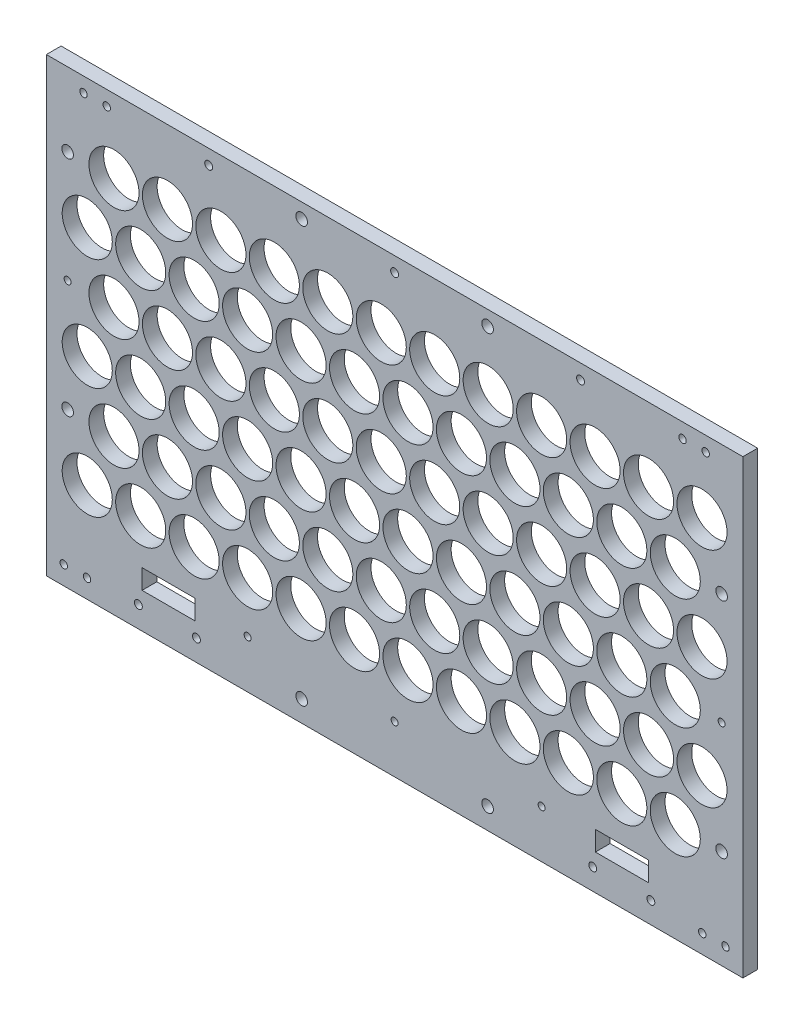
from build123d import *

# Parameters (mm, degrees)
SKETCH1_W                  = 299.700000132
SKETCH1_H                  = 194.250000104
BOSS_EXTRUDE1_DEPTH        = 6.35
CUT_EXTRUDE1_DEPTH         = 182.719853184
SKETCH4_R                  = 10.775
CUT_EXTRUDE2_DEPTH         = 182.719853184
LPATTERN1_COUNT            = 12
LPATTERN1_PITCH            = 23
LPATTERN2_COPY_1_DEPTH     = 182.719853184
LPATTERN2_COPY_2_DEPTH     = 182.719853184
LPATTERN2_COPY_3_DEPTH     = 182.719853184
LPATTERN2_COPY_4_DEPTH     = 182.719853184
LPATTERN2_COPY_5_DEPTH     = 182.719853184
LPATTERN2_COPY_6_DEPTH     = 182.719853184
LPATTERN2_COPY_7_DEPTH     = 182.719853184
LPATTERN2_COPY_8_DEPTH     = 182.719853184
LPATTERN2_COPY_9_DEPTH     = 182.719853184
LPATTERN2_COPY_10_DEPTH    = 182.719853184
LPATTERN2_COPY_11_DEPTH    = 182.719853184
LPATTERN2_COPY_12_DEPTH    = 182.719853184
LPATTERN2_COPY_13_DEPTH    = 182.719853184
LPATTERN2_COPY_14_DEPTH    = 182.719853184
LPATTERN2_COPY_15_DEPTH    = 182.719853184
LPATTERN2_COPY_16_DEPTH    = 182.719853184
LPATTERN2_COPY_17_DEPTH    = 182.719853184
LPATTERN2_COPY_18_DEPTH    = 182.719853184
LPATTERN2_COPY_19_DEPTH    = 182.719853184
LPATTERN2_COPY_20_DEPTH    = 182.719853184
LPATTERN2_COPY_21_DEPTH    = 182.719853184
LPATTERN2_COPY_22_DEPTH    = 182.719853184
LPATTERN2_COPY_23_SKETCH_R = 10.775
LPATTERN2_COPY_23_DEPTH    = 182.719853184
LPATTERN2_COPY_24_SKETCH_R = 10.775
LPATTERN2_COPY_24_DEPTH    = 182.719853184
LPATTERN2_COPY_25_SKETCH_R = 10.775
LPATTERN2_COPY_25_DEPTH    = 182.719853184
LPATTERN2_COPY_26_SKETCH_R = 10.775
LPATTERN2_COPY_26_DEPTH    = 182.719853184
LPATTERN2_COPY_27_SKETCH_R = 10.775
LPATTERN2_COPY_27_DEPTH    = 182.719853184
LPATTERN2_COPY_28_SKETCH_R = 10.775
LPATTERN2_COPY_28_DEPTH    = 182.719853184
LPATTERN2_COPY_29_SKETCH_R = 10.775
LPATTERN2_COPY_29_DEPTH    = 182.719853184
LPATTERN2_COPY_30_SKETCH_R = 10.775
LPATTERN2_COPY_30_DEPTH    = 182.719853184
LPATTERN2_COPY_31_SKETCH_R = 10.775
LPATTERN2_COPY_31_DEPTH    = 182.719853184
LPATTERN2_COPY_32_SKETCH_R = 10.775
LPATTERN2_COPY_32_DEPTH    = 182.719853184
LPATTERN2_COPY_33_SKETCH_R = 10.775
LPATTERN2_COPY_33_DEPTH    = 182.719853184
LPATTERN2_COPY_34_SKETCH_R = 10.775
LPATTERN2_COPY_34_DEPTH    = 182.719853184
LPATTERN2_COPY_35_SKETCH_R = 10.775
LPATTERN2_COPY_35_DEPTH    = 182.719853184
LPATTERN2_COPY_36_SKETCH_R = 10.775
LPATTERN2_COPY_36_DEPTH    = 182.719853184
LPATTERN2_COPY_37_SKETCH_R = 10.775
LPATTERN2_COPY_37_DEPTH    = 182.719853184
LPATTERN2_COPY_38_SKETCH_R = 10.775
LPATTERN2_COPY_38_DEPTH    = 182.719853184
LPATTERN2_COPY_39_SKETCH_R = 10.775
LPATTERN2_COPY_39_DEPTH    = 182.719853184
LPATTERN2_COPY_40_SKETCH_R = 10.775
LPATTERN2_COPY_40_DEPTH    = 182.719853184
LPATTERN2_COPY_41_SKETCH_R = 10.775
LPATTERN2_COPY_41_DEPTH    = 182.719853184
LPATTERN2_COPY_42_SKETCH_R = 10.775
LPATTERN2_COPY_42_DEPTH    = 182.719853184
LPATTERN2_COPY_43_SKETCH_R = 10.775
LPATTERN2_COPY_43_DEPTH    = 182.719853184
LPATTERN2_COPY_44_SKETCH_R = 10.775
LPATTERN2_COPY_44_DEPTH    = 182.719853184
LPATTERN2_COPY_45_DEPTH    = 182.719853184
LPATTERN2_COPY_46_DEPTH    = 182.719853184
LPATTERN2_COPY_47_SKETCH_R = 10.775
LPATTERN2_COPY_47_DEPTH    = 182.719853184
LPATTERN2_COPY_48_SKETCH_R = 10.775
LPATTERN2_COPY_48_DEPTH    = 182.719853184
SKETCH5_W                  = 22.76
SKETCH5_H                  = 8.4615
CUT_EXTRUDE3_DEPTH         = 182.719853184
M3_CLEARANCE_HOLE1_D       = 3.2
M3_CLEARANCE_HOLE2_D       = 3.4
SKETCH14_R                 = 1.5
CUT_EXTRUDE4_DEPTH         = 182.719853184
SKETCH15_R                 = 2.5
CUT_EXTRUDE5_DEPTH         = 182.719853184


with BuildPart() as part:
    # Sketch1 → Boss-Extrude1 (new body)
    with BuildSketch(Plane.XY):
        with Locations((0, -5.475000052)):
            Rectangle(SKETCH1_W, SKETCH1_H)
    extrude(amount=BOSS_EXTRUDE1_DEPTH)

    # Sketch3 → Cut-Extrude1 (cut, through all)
    with BuildSketch(Plane.XY.offset(6.35)):
        with BuildLine():
            ThreePointArc((-121.475, -60), (-132.24999993, -49.225), (-143.025, -59.999999859))
            ThreePointArc((-143.025, -59.999999859), (-139.869075617, -67.619075517), (-132.25, -70.775))
            ThreePointArc((-132.25, -70.775), (-124.630924433, -67.619075567), (-121.475, -60))
        make_face()
    cut_extrude1 = extrude(amount=-CUT_EXTRUDE1_DEPTH, mode=Mode.SUBTRACT)

    # Sketch4 → Cut-Extrude2 (cut, through all)
    with BuildSketch(Plane.XY.offset(6.35)):
        with Locations((-120.75, -36)):
            Circle(SKETCH4_R)
    cut_extrude2 = extrude(amount=-CUT_EXTRUDE2_DEPTH, mode=Mode.SUBTRACT)

    # LPattern1: Cut-Extrude1, Cut-Extrude2 ×12
    with Locations(*[(i * LPATTERN1_PITCH, 0, 0) for i in range(1, LPATTERN1_COUNT)]):
        add(cut_extrude1, mode=Mode.SUBTRACT)
        add(cut_extrude2, mode=Mode.SUBTRACT)

    # LPattern2 copy 1 sketch → LPattern2 copy 1 (cut, through all)
    with BuildSketch(Plane(origin=(23, 48, 6.35), x_dir=(1, 0, 0), z_dir=(0, 0, 1))):
        with BuildLine():
            ThreePointArc((-121.475, -60), (-132.24999993, -49.225), (-143.025, -59.999999859))
            ThreePointArc((-143.025, -59.999999859), (-139.869075617, -67.619075517), (-132.25, -70.775))
            ThreePointArc((-132.25, -70.775), (-124.630924433, -67.619075567), (-121.475, -60))
        make_face()
    extrude(amount=-LPATTERN2_COPY_1_DEPTH, mode=Mode.SUBTRACT)

    # LPattern2 copy 2 sketch → LPattern2 copy 2 (cut, through all)
    with BuildSketch(Plane(origin=(23, 96, 6.35), x_dir=(1, 0, 0), z_dir=(0, 0, 1))):
        with BuildLine():
            ThreePointArc((-121.475, -60), (-132.24999993, -49.225), (-143.025, -59.999999859))
            ThreePointArc((-143.025, -59.999999859), (-139.869075617, -67.619075517), (-132.25, -70.775))
            ThreePointArc((-132.25, -70.775), (-124.630924433, -67.619075567), (-121.475, -60))
        make_face()
    extrude(amount=-LPATTERN2_COPY_2_DEPTH, mode=Mode.SUBTRACT)

    # LPattern2 copy 3 sketch → LPattern2 copy 3 (cut, through all)
    with BuildSketch(Plane(origin=(46, 48, 6.35), x_dir=(1, 0, 0), z_dir=(0, 0, 1))):
        with BuildLine():
            ThreePointArc((-121.475, -60), (-132.24999993, -49.225), (-143.025, -59.999999859))
            ThreePointArc((-143.025, -59.999999859), (-139.869075617, -67.619075517), (-132.25, -70.775))
            ThreePointArc((-132.25, -70.775), (-124.630924433, -67.619075567), (-121.475, -60))
        make_face()
    extrude(amount=-LPATTERN2_COPY_3_DEPTH, mode=Mode.SUBTRACT)

    # LPattern2 copy 4 sketch → LPattern2 copy 4 (cut, through all)
    with BuildSketch(Plane(origin=(46, 96, 6.35), x_dir=(1, 0, 0), z_dir=(0, 0, 1))):
        with BuildLine():
            ThreePointArc((-121.475, -60), (-132.24999993, -49.225), (-143.025, -59.999999859))
            ThreePointArc((-143.025, -59.999999859), (-139.869075617, -67.619075517), (-132.25, -70.775))
            ThreePointArc((-132.25, -70.775), (-124.630924433, -67.619075567), (-121.475, -60))
        make_face()
    extrude(amount=-LPATTERN2_COPY_4_DEPTH, mode=Mode.SUBTRACT)

    # LPattern2 copy 5 sketch → LPattern2 copy 5 (cut, through all)
    with BuildSketch(Plane(origin=(69, 48, 6.35), x_dir=(1, 0, 0), z_dir=(0, 0, 1))):
        with BuildLine():
            ThreePointArc((-121.475, -60), (-132.24999993, -49.225), (-143.025, -59.999999859))
            ThreePointArc((-143.025, -59.999999859), (-139.869075617, -67.619075517), (-132.25, -70.775))
            ThreePointArc((-132.25, -70.775), (-124.630924433, -67.619075567), (-121.475, -60))
        make_face()
    extrude(amount=-LPATTERN2_COPY_5_DEPTH, mode=Mode.SUBTRACT)

    # LPattern2 copy 6 sketch → LPattern2 copy 6 (cut, through all)
    with BuildSketch(Plane(origin=(69, 96, 6.35), x_dir=(1, 0, 0), z_dir=(0, 0, 1))):
        with BuildLine():
            ThreePointArc((-121.475, -60), (-132.24999993, -49.225), (-143.025, -59.999999859))
            ThreePointArc((-143.025, -59.999999859), (-139.869075617, -67.619075517), (-132.25, -70.775))
            ThreePointArc((-132.25, -70.775), (-124.630924433, -67.619075567), (-121.475, -60))
        make_face()
    extrude(amount=-LPATTERN2_COPY_6_DEPTH, mode=Mode.SUBTRACT)

    # LPattern2 copy 7 sketch → LPattern2 copy 7 (cut, through all)
    with BuildSketch(Plane(origin=(92, 48, 6.35), x_dir=(1, 0, 0), z_dir=(0, 0, 1))):
        with BuildLine():
            ThreePointArc((-121.475, -60), (-132.24999993, -49.225), (-143.025, -59.999999859))
            ThreePointArc((-143.025, -59.999999859), (-139.869075617, -67.619075517), (-132.25, -70.775))
            ThreePointArc((-132.25, -70.775), (-124.630924433, -67.619075567), (-121.475, -60))
        make_face()
    extrude(amount=-LPATTERN2_COPY_7_DEPTH, mode=Mode.SUBTRACT)

    # LPattern2 copy 8 sketch → LPattern2 copy 8 (cut, through all)
    with BuildSketch(Plane(origin=(92, 96, 6.35), x_dir=(1, 0, 0), z_dir=(0, 0, 1))):
        with BuildLine():
            ThreePointArc((-121.475, -60), (-132.24999993, -49.225), (-143.025, -59.999999859))
            ThreePointArc((-143.025, -59.999999859), (-139.869075617, -67.619075517), (-132.25, -70.775))
            ThreePointArc((-132.25, -70.775), (-124.630924433, -67.619075567), (-121.475, -60))
        make_face()
    extrude(amount=-LPATTERN2_COPY_8_DEPTH, mode=Mode.SUBTRACT)

    # LPattern2 copy 9 sketch → LPattern2 copy 9 (cut, through all)
    with BuildSketch(Plane(origin=(115, 48, 6.35), x_dir=(1, 0, 0), z_dir=(0, 0, 1))):
        with BuildLine():
            ThreePointArc((-121.475, -60), (-132.24999993, -49.225), (-143.025, -59.999999859))
            ThreePointArc((-143.025, -59.999999859), (-139.869075617, -67.619075517), (-132.25, -70.775))
            ThreePointArc((-132.25, -70.775), (-124.630924433, -67.619075567), (-121.475, -60))
        make_face()
    extrude(amount=-LPATTERN2_COPY_9_DEPTH, mode=Mode.SUBTRACT)

    # LPattern2 copy 10 sketch → LPattern2 copy 10 (cut, through all)
    with BuildSketch(Plane(origin=(115, 96, 6.35), x_dir=(1, 0, 0), z_dir=(0, 0, 1))):
        with BuildLine():
            ThreePointArc((-121.475, -60), (-132.24999993, -49.225), (-143.025, -59.999999859))
            ThreePointArc((-143.025, -59.999999859), (-139.869075617, -67.619075517), (-132.25, -70.775))
            ThreePointArc((-132.25, -70.775), (-124.630924433, -67.619075567), (-121.475, -60))
        make_face()
    extrude(amount=-LPATTERN2_COPY_10_DEPTH, mode=Mode.SUBTRACT)

    # LPattern2 copy 11 sketch → LPattern2 copy 11 (cut, through all)
    with BuildSketch(Plane(origin=(138, 48, 6.35), x_dir=(1, 0, 0), z_dir=(0, 0, 1))):
        with BuildLine():
            ThreePointArc((-121.475, -60), (-132.24999993, -49.225), (-143.025, -59.999999859))
            ThreePointArc((-143.025, -59.999999859), (-139.869075617, -67.619075517), (-132.25, -70.775))
            ThreePointArc((-132.25, -70.775), (-124.630924433, -67.619075567), (-121.475, -60))
        make_face()
    extrude(amount=-LPATTERN2_COPY_11_DEPTH, mode=Mode.SUBTRACT)

    # LPattern2 copy 12 sketch → LPattern2 copy 12 (cut, through all)
    with BuildSketch(Plane(origin=(138, 96, 6.35), x_dir=(1, 0, 0), z_dir=(0, 0, 1))):
        with BuildLine():
            ThreePointArc((-121.475, -60), (-132.24999993, -49.225), (-143.025, -59.999999859))
            ThreePointArc((-143.025, -59.999999859), (-139.869075617, -67.619075517), (-132.25, -70.775))
            ThreePointArc((-132.25, -70.775), (-124.630924433, -67.619075567), (-121.475, -60))
        make_face()
    extrude(amount=-LPATTERN2_COPY_12_DEPTH, mode=Mode.SUBTRACT)

    # LPattern2 copy 13 sketch → LPattern2 copy 13 (cut, through all)
    with BuildSketch(Plane(origin=(161, 48, 6.35), x_dir=(1, 0, 0), z_dir=(0, 0, 1))):
        with BuildLine():
            ThreePointArc((-121.475, -60), (-132.24999993, -49.225), (-143.025, -59.999999859))
            ThreePointArc((-143.025, -59.999999859), (-139.869075617, -67.619075517), (-132.25, -70.775))
            ThreePointArc((-132.25, -70.775), (-124.630924433, -67.619075567), (-121.475, -60))
        make_face()
    extrude(amount=-LPATTERN2_COPY_13_DEPTH, mode=Mode.SUBTRACT)

    # LPattern2 copy 14 sketch → LPattern2 copy 14 (cut, through all)
    with BuildSketch(Plane(origin=(161, 96, 6.35), x_dir=(1, 0, 0), z_dir=(0, 0, 1))):
        with BuildLine():
            ThreePointArc((-121.475, -60), (-132.24999993, -49.225), (-143.025, -59.999999859))
            ThreePointArc((-143.025, -59.999999859), (-139.869075617, -67.619075517), (-132.25, -70.775))
            ThreePointArc((-132.25, -70.775), (-124.630924433, -67.619075567), (-121.475, -60))
        make_face()
    extrude(amount=-LPATTERN2_COPY_14_DEPTH, mode=Mode.SUBTRACT)

    # LPattern2 copy 15 sketch → LPattern2 copy 15 (cut, through all)
    with BuildSketch(Plane(origin=(184, 48, 6.35), x_dir=(1, 0, 0), z_dir=(0, 0, 1))):
        with BuildLine():
            ThreePointArc((-121.475, -60), (-132.24999993, -49.225), (-143.025, -59.999999859))
            ThreePointArc((-143.025, -59.999999859), (-139.869075617, -67.619075517), (-132.25, -70.775))
            ThreePointArc((-132.25, -70.775), (-124.630924433, -67.619075567), (-121.475, -60))
        make_face()
    extrude(amount=-LPATTERN2_COPY_15_DEPTH, mode=Mode.SUBTRACT)

    # LPattern2 copy 16 sketch → LPattern2 copy 16 (cut, through all)
    with BuildSketch(Plane(origin=(184, 96, 6.35), x_dir=(1, 0, 0), z_dir=(0, 0, 1))):
        with BuildLine():
            ThreePointArc((-121.475, -60), (-132.24999993, -49.225), (-143.025, -59.999999859))
            ThreePointArc((-143.025, -59.999999859), (-139.869075617, -67.619075517), (-132.25, -70.775))
            ThreePointArc((-132.25, -70.775), (-124.630924433, -67.619075567), (-121.475, -60))
        make_face()
    extrude(amount=-LPATTERN2_COPY_16_DEPTH, mode=Mode.SUBTRACT)

    # LPattern2 copy 17 sketch → LPattern2 copy 17 (cut, through all)
    with BuildSketch(Plane(origin=(207, 48, 6.35), x_dir=(1, 0, 0), z_dir=(0, 0, 1))):
        with BuildLine():
            ThreePointArc((-121.475, -60), (-132.24999993, -49.225), (-143.025, -59.999999859))
            ThreePointArc((-143.025, -59.999999859), (-139.869075617, -67.619075517), (-132.25, -70.775))
            ThreePointArc((-132.25, -70.775), (-124.630924433, -67.619075567), (-121.475, -60))
        make_face()
    extrude(amount=-LPATTERN2_COPY_17_DEPTH, mode=Mode.SUBTRACT)

    # LPattern2 copy 18 sketch → LPattern2 copy 18 (cut, through all)
    with BuildSketch(Plane(origin=(207, 96, 6.35), x_dir=(1, 0, 0), z_dir=(0, 0, 1))):
        with BuildLine():
            ThreePointArc((-121.475, -60), (-132.24999993, -49.225), (-143.025, -59.999999859))
            ThreePointArc((-143.025, -59.999999859), (-139.869075617, -67.619075517), (-132.25, -70.775))
            ThreePointArc((-132.25, -70.775), (-124.630924433, -67.619075567), (-121.475, -60))
        make_face()
    extrude(amount=-LPATTERN2_COPY_18_DEPTH, mode=Mode.SUBTRACT)

    # LPattern2 copy 19 sketch → LPattern2 copy 19 (cut, through all)
    with BuildSketch(Plane(origin=(230, 48, 6.35), x_dir=(1, 0, 0), z_dir=(0, 0, 1))):
        with BuildLine():
            ThreePointArc((-121.475, -60), (-132.24999993, -49.225), (-143.025, -59.999999859))
            ThreePointArc((-143.025, -59.999999859), (-139.869075617, -67.619075517), (-132.25, -70.775))
            ThreePointArc((-132.25, -70.775), (-124.630924433, -67.619075567), (-121.475, -60))
        make_face()
    extrude(amount=-LPATTERN2_COPY_19_DEPTH, mode=Mode.SUBTRACT)

    # LPattern2 copy 20 sketch → LPattern2 copy 20 (cut, through all)
    with BuildSketch(Plane(origin=(230, 96, 6.35), x_dir=(1, 0, 0), z_dir=(0, 0, 1))):
        with BuildLine():
            ThreePointArc((-121.475, -60), (-132.24999993, -49.225), (-143.025, -59.999999859))
            ThreePointArc((-143.025, -59.999999859), (-139.869075617, -67.619075517), (-132.25, -70.775))
            ThreePointArc((-132.25, -70.775), (-124.630924433, -67.619075567), (-121.475, -60))
        make_face()
    extrude(amount=-LPATTERN2_COPY_20_DEPTH, mode=Mode.SUBTRACT)

    # LPattern2 copy 21 sketch → LPattern2 copy 21 (cut, through all)
    with BuildSketch(Plane(origin=(253, 48, 6.35), x_dir=(1, 0, 0), z_dir=(0, 0, 1))):
        with BuildLine():
            ThreePointArc((-121.475, -60), (-132.24999993, -49.225), (-143.025, -59.999999859))
            ThreePointArc((-143.025, -59.999999859), (-139.869075617, -67.619075517), (-132.25, -70.775))
            ThreePointArc((-132.25, -70.775), (-124.630924433, -67.619075567), (-121.475, -60))
        make_face()
    extrude(amount=-LPATTERN2_COPY_21_DEPTH, mode=Mode.SUBTRACT)

    # LPattern2 copy 22 sketch → LPattern2 copy 22 (cut, through all)
    with BuildSketch(Plane(origin=(253, 96, 6.35), x_dir=(1, 0, 0), z_dir=(0, 0, 1))):
        with BuildLine():
            ThreePointArc((-121.475, -60), (-132.24999993, -49.225), (-143.025, -59.999999859))
            ThreePointArc((-143.025, -59.999999859), (-139.869075617, -67.619075517), (-132.25, -70.775))
            ThreePointArc((-132.25, -70.775), (-124.630924433, -67.619075567), (-121.475, -60))
        make_face()
    extrude(amount=-LPATTERN2_COPY_22_DEPTH, mode=Mode.SUBTRACT)

    # LPattern2 copy 23 sketch → LPattern2 copy 23 (cut, through all)
    with BuildSketch(Plane(origin=(23, 48, 6.35), x_dir=(1, 0, 0), z_dir=(0, 0, 1))):
        with Locations((-120.75, -36)):
            Circle(LPATTERN2_COPY_23_SKETCH_R)
    extrude(amount=-LPATTERN2_COPY_23_DEPTH, mode=Mode.SUBTRACT)

    # LPattern2 copy 24 sketch → LPattern2 copy 24 (cut, through all)
    with BuildSketch(Plane(origin=(23, 96, 6.35), x_dir=(1, 0, 0), z_dir=(0, 0, 1))):
        with Locations((-120.75, -36)):
            Circle(LPATTERN2_COPY_24_SKETCH_R)
    extrude(amount=-LPATTERN2_COPY_24_DEPTH, mode=Mode.SUBTRACT)

    # LPattern2 copy 25 sketch → LPattern2 copy 25 (cut, through all)
    with BuildSketch(Plane(origin=(46, 48, 6.35), x_dir=(1, 0, 0), z_dir=(0, 0, 1))):
        with Locations((-120.75, -36)):
            Circle(LPATTERN2_COPY_25_SKETCH_R)
    extrude(amount=-LPATTERN2_COPY_25_DEPTH, mode=Mode.SUBTRACT)

    # LPattern2 copy 26 sketch → LPattern2 copy 26 (cut, through all)
    with BuildSketch(Plane(origin=(46, 96, 6.35), x_dir=(1, 0, 0), z_dir=(0, 0, 1))):
        with Locations((-120.75, -36)):
            Circle(LPATTERN2_COPY_26_SKETCH_R)
    extrude(amount=-LPATTERN2_COPY_26_DEPTH, mode=Mode.SUBTRACT)

    # LPattern2 copy 27 sketch → LPattern2 copy 27 (cut, through all)
    with BuildSketch(Plane(origin=(69, 48, 6.35), x_dir=(1, 0, 0), z_dir=(0, 0, 1))):
        with Locations((-120.75, -36)):
            Circle(LPATTERN2_COPY_27_SKETCH_R)
    extrude(amount=-LPATTERN2_COPY_27_DEPTH, mode=Mode.SUBTRACT)

    # LPattern2 copy 28 sketch → LPattern2 copy 28 (cut, through all)
    with BuildSketch(Plane(origin=(69, 96, 6.35), x_dir=(1, 0, 0), z_dir=(0, 0, 1))):
        with Locations((-120.75, -36)):
            Circle(LPATTERN2_COPY_28_SKETCH_R)
    extrude(amount=-LPATTERN2_COPY_28_DEPTH, mode=Mode.SUBTRACT)

    # LPattern2 copy 29 sketch → LPattern2 copy 29 (cut, through all)
    with BuildSketch(Plane(origin=(92, 48, 6.35), x_dir=(1, 0, 0), z_dir=(0, 0, 1))):
        with Locations((-120.75, -36)):
            Circle(LPATTERN2_COPY_29_SKETCH_R)
    extrude(amount=-LPATTERN2_COPY_29_DEPTH, mode=Mode.SUBTRACT)

    # LPattern2 copy 30 sketch → LPattern2 copy 30 (cut, through all)
    with BuildSketch(Plane(origin=(92, 96, 6.35), x_dir=(1, 0, 0), z_dir=(0, 0, 1))):
        with Locations((-120.75, -36)):
            Circle(LPATTERN2_COPY_30_SKETCH_R)
    extrude(amount=-LPATTERN2_COPY_30_DEPTH, mode=Mode.SUBTRACT)

    # LPattern2 copy 31 sketch → LPattern2 copy 31 (cut, through all)
    with BuildSketch(Plane(origin=(115, 48, 6.35), x_dir=(1, 0, 0), z_dir=(0, 0, 1))):
        with Locations((-120.75, -36)):
            Circle(LPATTERN2_COPY_31_SKETCH_R)
    extrude(amount=-LPATTERN2_COPY_31_DEPTH, mode=Mode.SUBTRACT)

    # LPattern2 copy 32 sketch → LPattern2 copy 32 (cut, through all)
    with BuildSketch(Plane(origin=(115, 96, 6.35), x_dir=(1, 0, 0), z_dir=(0, 0, 1))):
        with Locations((-120.75, -36)):
            Circle(LPATTERN2_COPY_32_SKETCH_R)
    extrude(amount=-LPATTERN2_COPY_32_DEPTH, mode=Mode.SUBTRACT)

    # LPattern2 copy 33 sketch → LPattern2 copy 33 (cut, through all)
    with BuildSketch(Plane(origin=(138, 48, 6.35), x_dir=(1, 0, 0), z_dir=(0, 0, 1))):
        with Locations((-120.75, -36)):
            Circle(LPATTERN2_COPY_33_SKETCH_R)
    extrude(amount=-LPATTERN2_COPY_33_DEPTH, mode=Mode.SUBTRACT)

    # LPattern2 copy 34 sketch → LPattern2 copy 34 (cut, through all)
    with BuildSketch(Plane(origin=(138, 96, 6.35), x_dir=(1, 0, 0), z_dir=(0, 0, 1))):
        with Locations((-120.75, -36)):
            Circle(LPATTERN2_COPY_34_SKETCH_R)
    extrude(amount=-LPATTERN2_COPY_34_DEPTH, mode=Mode.SUBTRACT)

    # LPattern2 copy 35 sketch → LPattern2 copy 35 (cut, through all)
    with BuildSketch(Plane(origin=(161, 48, 6.35), x_dir=(1, 0, 0), z_dir=(0, 0, 1))):
        with Locations((-120.75, -36)):
            Circle(LPATTERN2_COPY_35_SKETCH_R)
    extrude(amount=-LPATTERN2_COPY_35_DEPTH, mode=Mode.SUBTRACT)

    # LPattern2 copy 36 sketch → LPattern2 copy 36 (cut, through all)
    with BuildSketch(Plane(origin=(161, 96, 6.35), x_dir=(1, 0, 0), z_dir=(0, 0, 1))):
        with Locations((-120.75, -36)):
            Circle(LPATTERN2_COPY_36_SKETCH_R)
    extrude(amount=-LPATTERN2_COPY_36_DEPTH, mode=Mode.SUBTRACT)

    # LPattern2 copy 37 sketch → LPattern2 copy 37 (cut, through all)
    with BuildSketch(Plane(origin=(184, 48, 6.35), x_dir=(1, 0, 0), z_dir=(0, 0, 1))):
        with Locations((-120.75, -36)):
            Circle(LPATTERN2_COPY_37_SKETCH_R)
    extrude(amount=-LPATTERN2_COPY_37_DEPTH, mode=Mode.SUBTRACT)

    # LPattern2 copy 38 sketch → LPattern2 copy 38 (cut, through all)
    with BuildSketch(Plane(origin=(184, 96, 6.35), x_dir=(1, 0, 0), z_dir=(0, 0, 1))):
        with Locations((-120.75, -36)):
            Circle(LPATTERN2_COPY_38_SKETCH_R)
    extrude(amount=-LPATTERN2_COPY_38_DEPTH, mode=Mode.SUBTRACT)

    # LPattern2 copy 39 sketch → LPattern2 copy 39 (cut, through all)
    with BuildSketch(Plane(origin=(207, 48, 6.35), x_dir=(1, 0, 0), z_dir=(0, 0, 1))):
        with Locations((-120.75, -36)):
            Circle(LPATTERN2_COPY_39_SKETCH_R)
    extrude(amount=-LPATTERN2_COPY_39_DEPTH, mode=Mode.SUBTRACT)

    # LPattern2 copy 40 sketch → LPattern2 copy 40 (cut, through all)
    with BuildSketch(Plane(origin=(207, 96, 6.35), x_dir=(1, 0, 0), z_dir=(0, 0, 1))):
        with Locations((-120.75, -36)):
            Circle(LPATTERN2_COPY_40_SKETCH_R)
    extrude(amount=-LPATTERN2_COPY_40_DEPTH, mode=Mode.SUBTRACT)

    # LPattern2 copy 41 sketch → LPattern2 copy 41 (cut, through all)
    with BuildSketch(Plane(origin=(230, 48, 6.35), x_dir=(1, 0, 0), z_dir=(0, 0, 1))):
        with Locations((-120.75, -36)):
            Circle(LPATTERN2_COPY_41_SKETCH_R)
    extrude(amount=-LPATTERN2_COPY_41_DEPTH, mode=Mode.SUBTRACT)

    # LPattern2 copy 42 sketch → LPattern2 copy 42 (cut, through all)
    with BuildSketch(Plane(origin=(230, 96, 6.35), x_dir=(1, 0, 0), z_dir=(0, 0, 1))):
        with Locations((-120.75, -36)):
            Circle(LPATTERN2_COPY_42_SKETCH_R)
    extrude(amount=-LPATTERN2_COPY_42_DEPTH, mode=Mode.SUBTRACT)

    # LPattern2 copy 43 sketch → LPattern2 copy 43 (cut, through all)
    with BuildSketch(Plane(origin=(253, 48, 6.35), x_dir=(1, 0, 0), z_dir=(0, 0, 1))):
        with Locations((-120.75, -36)):
            Circle(LPATTERN2_COPY_43_SKETCH_R)
    extrude(amount=-LPATTERN2_COPY_43_DEPTH, mode=Mode.SUBTRACT)

    # LPattern2 copy 44 sketch → LPattern2 copy 44 (cut, through all)
    with BuildSketch(Plane(origin=(253, 96, 6.35), x_dir=(1, 0, 0), z_dir=(0, 0, 1))):
        with Locations((-120.75, -36)):
            Circle(LPATTERN2_COPY_44_SKETCH_R)
    extrude(amount=-LPATTERN2_COPY_44_DEPTH, mode=Mode.SUBTRACT)

    # LPattern2 copy 45 sketch → LPattern2 copy 45 (cut, through all)
    with BuildSketch(Plane(origin=(0, 48, 6.35), x_dir=(1, 0, 0), z_dir=(0, 0, 1))):
        with BuildLine():
            ThreePointArc((-121.475, -60), (-132.24999993, -49.225), (-143.025, -59.999999859))
            ThreePointArc((-143.025, -59.999999859), (-139.869075617, -67.619075517), (-132.25, -70.775))
            ThreePointArc((-132.25, -70.775), (-124.630924433, -67.619075567), (-121.475, -60))
        make_face()
    extrude(amount=-LPATTERN2_COPY_45_DEPTH, mode=Mode.SUBTRACT)

    # LPattern2 copy 46 sketch → LPattern2 copy 46 (cut, through all)
    with BuildSketch(Plane(origin=(0, 96, 6.35), x_dir=(1, 0, 0), z_dir=(0, 0, 1))):
        with BuildLine():
            ThreePointArc((-121.475, -60), (-132.24999993, -49.225), (-143.025, -59.999999859))
            ThreePointArc((-143.025, -59.999999859), (-139.869075617, -67.619075517), (-132.25, -70.775))
            ThreePointArc((-132.25, -70.775), (-124.630924433, -67.619075567), (-121.475, -60))
        make_face()
    extrude(amount=-LPATTERN2_COPY_46_DEPTH, mode=Mode.SUBTRACT)

    # LPattern2 copy 47 sketch → LPattern2 copy 47 (cut, through all)
    with BuildSketch(Plane(origin=(0, 48, 6.35), x_dir=(1, 0, 0), z_dir=(0, 0, 1))):
        with Locations((-120.75, -36)):
            Circle(LPATTERN2_COPY_47_SKETCH_R)
    extrude(amount=-LPATTERN2_COPY_47_DEPTH, mode=Mode.SUBTRACT)

    # LPattern2 copy 48 sketch → LPattern2 copy 48 (cut, through all)
    with BuildSketch(Plane(origin=(0, 96, 6.35), x_dir=(1, 0, 0), z_dir=(0, 0, 1))):
        with Locations((-120.75, -36)):
            Circle(LPATTERN2_COPY_48_SKETCH_R)
    extrude(amount=-LPATTERN2_COPY_48_DEPTH, mode=Mode.SUBTRACT)

    # Sketch5 → Cut-Extrude3 (cut, through all)
    with BuildSketch(Plane.XY.offset(6.35)):
        with Locations((97.75, -83.18075)):
            Rectangle(SKETCH5_W, SKETCH5_H)
        with Locations((-97.288, -83.18075)):
            Rectangle(SKETCH5_W, SKETCH5_H)
    extrude(amount=-CUT_EXTRUDE3_DEPTH, mode=Mode.SUBTRACT)

    # M3 Clearance Hole1 (through all)
    with Locations(Plane.XY.offset(6.35)):
        with Locations((123.850000066, 85.3), (133.850000066, 85.3), (-123.850000066, 85.3), (-133.850000066, 85.3), (-142.350000066, -94.6000001), (-132.350000066, -94.6000001), (132.350000066, -94.6000001), (142.350000066, -94.6000001)):
            Hole(M3_CLEARANCE_HOLE1_D / 2)

    # M3 Clearance Hole2 (through all)
    with Locations(Plane.XY.offset(6.35)):
        with Locations((110.25, -93.50575), (85.25, -93.50575), (80, 85.3), (0, 85.3), (-80, 85.3), (-85.25, -93.50575), (-110.25, -93.50575)):
            Hole(M3_CLEARANCE_HOLE2_D / 2)

    # Sketch14 → Cut-Extrude4 (cut, through all)
    with BuildSketch(Plane.XY.offset(6.35)):
        with Locations((140.687500033, -12)):
            Circle(SKETCH14_R)
        with Locations((-140.687500033, 12)):
            Circle(SKETCH14_R)
        with Locations((63.25, -81.95)):
            Circle(SKETCH14_R)
        with Locations((-63.25, -81.95)):
            Circle(SKETCH14_R)
        with Locations((0, -81.95)):
            Circle(SKETCH14_R)
    extrude(amount=-CUT_EXTRUDE4_DEPTH, mode=Mode.SUBTRACT)

    # Sketch15 → Cut-Extrude5 (cut, through all)
    with BuildSketch(Plane.XY.offset(6.35)):
        with Locations((40, 85.3)):
            Circle(SKETCH15_R)
        with Locations((-40, 85.3)):
            Circle(SKETCH15_R)
        with Locations((140.687500033, 36)):
            Circle(SKETCH15_R)
        with Locations((140.687500033, -60)):
            Circle(SKETCH15_R)
        with Locations((-140.687500033, -36)):
            Circle(SKETCH15_R)
        with Locations((-140.687500033, 60)):
            Circle(SKETCH15_R)
        with Locations((40, -93.50575)):
            Circle(SKETCH15_R)
        with Locations((-40, -93.50575)):
            Circle(SKETCH15_R)
    extrude(amount=-CUT_EXTRUDE5_DEPTH, mode=Mode.SUBTRACT)


solid = part.part
